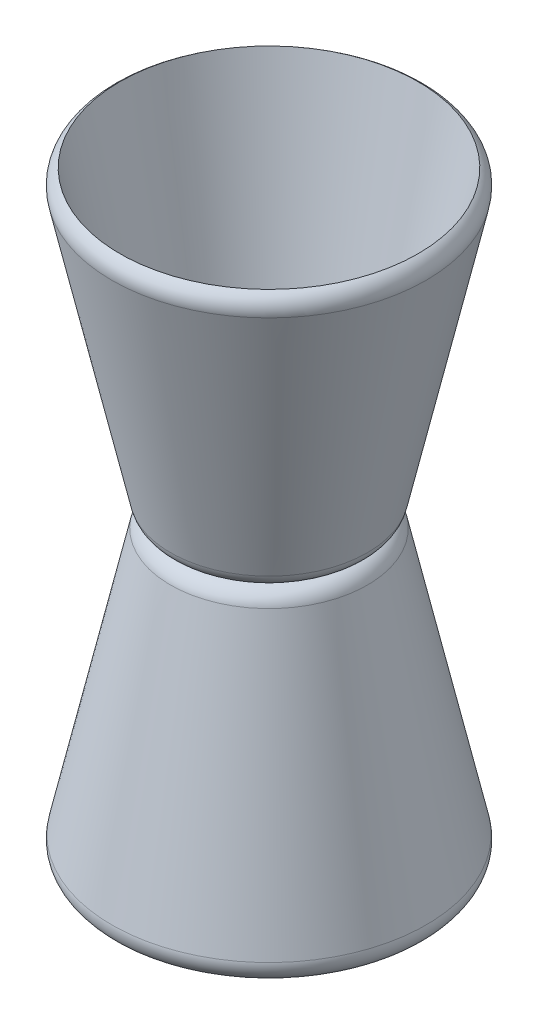
from build123d import *

# Parameters (mm, degrees)
FILLET1_R = 30


# Read off the part's stored shape, not the designer's step: Mirror1
with BuildPart() as part:
    # Sketch1 → Revolve1 (revolve)
    with BuildSketch(Plane.XY, mode=Mode.PRIVATE) as revolve1_sk:
        Polygon((0, -330.841690926), (0, -380.841690926), (160, -380.841690926), (270.482436132, 119.158309074), (250, 119.158309074), (150.565807481, -330.841690926), align=None)
    revolve(revolve1_sk.sketch.rotate(Axis((0, -330.841690926, 0), (0, -1, 0)), 180), axis=Axis((0, -330.841690926, 0), (0, -1, 0)))

    # Fillet1
    # the kernel refuses this fillet: 30 mm, written as the material it takes off along each edge
    with BuildSketch(Plane(origin=(0, -380.841690926, 0), x_dir=(-1, 0, 0), z_dir=(0, 0, 1))) as fillet1_piece_1:
        with BuildLine():
            CenterArc((160 - FILLET1_R * 0.803156934346, -FILLET1_R), FILLET1_R, 12.46013877, 77.53986123)
            Line((160 + FILLET1_R * 0.173289415634, -FILLET1_R * 0.784239657004), (160 + FILLET1_R * 0.192818342634, -FILLET1_R * 0.779924450144))
            Line((160 + FILLET1_R * 0.192818342634, -FILLET1_R * 0.779924450144), (160 + FILLET1_R * 0.0160631386869, FILLET1_R * 0.02))
            Line((160 + FILLET1_R * 0.0160631386869, FILLET1_R * 0.02), (160 - FILLET1_R * 0.803156934346, FILLET1_R * 0.02))
            Line((160 - FILLET1_R * 0.803156934346, FILLET1_R * 0.02), (160 - FILLET1_R * 0.803156934346, 0))
        make_face()
    revolve(axis=Axis((0, -380.841690926, 0), (0, -1, 0)), mode=Mode.SUBTRACT)
    with BuildSketch(Plane(origin=(0, 119.158309074, 0), x_dir=(-1, 0, 0), z_dir=(0, 0, 1))) as fillet1_piece_2:
        with BuildLine():
            CenterArc((234.132912434, 25.460469991), FILLET1_R, 301.931359404, 70.528779366)
            Line((250, 0), (250.317341751, -0.5092094))
            ThreePointArc((250.317341751, -0.5092094), (260.241218066, -0.6), (270.482436132, -0.6))
            Line((270.482436132, -0.6), (271.068303942, 0.129456206))
            Line((271.068303942, 0.129456206), (264.012170744, 32.062736487))
            Line((264.012170744, 32.062736487), (263.426302934, 31.933280281))
        make_face()
    revolve(axis=Axis((0, 119.158309074, 0), (0, -1, 0)), mode=Mode.SUBTRACT)

    # Mirror1 outline → Mirror1 (revolve)
    with BuildSketch(Plane.XY):
        with BuildLine():
            Line((0, -380.841690926), (0, -430.841690926))
            Line((0, -430.841690926), (150.565807481, -430.841690926))
            Line((150.565807481, -430.841690926), (250, -880.841690926))
            ThreePointArc((250, -880.841690926), (261.787944384, -867.008740354), (263.426302934, -848.908410644))
            Line((263.426302934, -848.908410644), (165.198682469, -404.368880636))
            ThreePointArc((165.198682469, -404.368880636), (154.691133597, -387.451689764), (135.90529197, -380.841690926))
            Line((135.90529197, -380.841690926), (0, -380.841690926))
        make_face()
    revolve(axis=Axis((0, 0, 0), (0, 1, 0)))


solid = part.part
